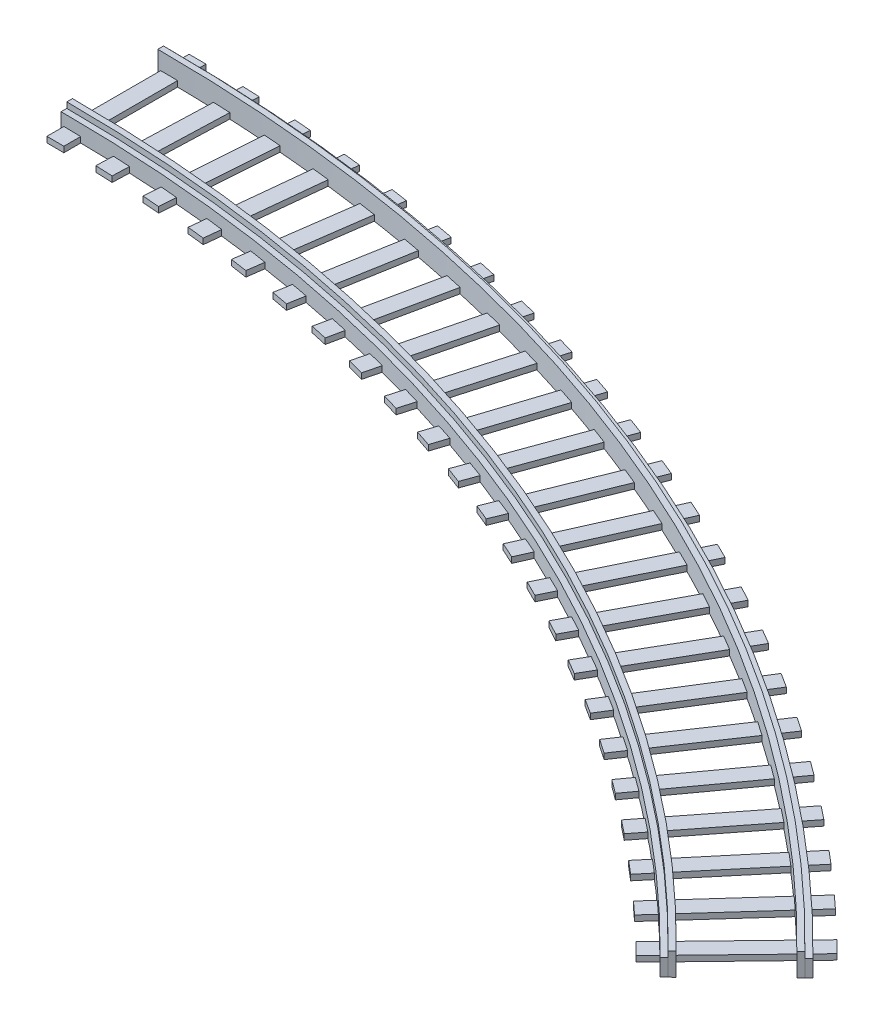
from build123d import *

# Parameters (mm, degrees)
BOSS_EXTRUDE1_DEPTH   = 4
BOSS_EXTRUDE1_2_DEPTH = 4
BOSS_EXTRUDE6_DEPTH   = 3
BOSS_EXTRUDE6_2_DEPTH = 3
BOSS_EXTRUDE3_DEPTH   = 1
CIRPATTERN2_COUNT     = 23
CIRPATTERN2_ANGLE     = 44


with BuildPart() as part:
    # Sketch1 → Boss-Extrude1 (new body)
    with BuildSketch(Plane(origin=(0, 0, 0), x_dir=(1, 0, 0), z_dir=(0, 1, 0))):
        with BuildLine():
            Line((193.554859662, 190.034414782), (194.268425964, 190.735002486))
            ThreePointArc((194.268425964, 190.735002486), (105.338639808, 251.045480866), (0, 272.25))
            Line((0, 272.25), (0, 271.25))
            ThreePointArc((0, 271.25), (104.951721021, 250.123367071), (193.554859662, 190.034414782))
        make_face()
    extrude(amount=BOSS_EXTRUDE1_DEPTH)


with BuildPart() as body_2:
    # Sketch1 → Boss-Extrude1 2 (new body)
    with BuildSketch(Plane(origin=(0, 0, 0), x_dir=(1, 0, 0), z_dir=(0, 1, 0))):
        with BuildLine():
            Line((182.851365118, 179.525599218), (182.137798815, 178.825011513))
            ThreePointArc((182.137798815, 178.825011513), (98.761020426, 235.36954634), (0, 255.25))
            Line((0, 255.25), (0, 256.25))
            ThreePointArc((0, 256.25), (99.147939213, 236.291660136), (182.851365118, 179.525599218))
        make_face()
    extrude(amount=BOSS_EXTRUDE1_2_DEPTH)


    add(part.part)  # Boss-Extrude3 merges part
    # Sketch3 → Boss-Extrude3 (add)
    with BuildSketch(Plane.XZ):
        with BuildLine():
            Line((0.5, -256.249512195), (0.5, -271.24953917))
            Line((0.5, -271.24953917), (0.5, -274.749545041))
            Line((0.5, -274.749545041), (0.5, -276.249547511))
            ThreePointArc((0.5, -276.249547511), (1.999988709, -276.242760168), (3.499918452, -276.227828198))
            Line((3.499918452, -276.227828198), (3.499918452, -274.727707141))
            Line((3.499918452, -274.727707141), (3.499918452, -271.227419467))
            Line((3.499918452, -271.227419467), (3.499918452, -256.22609756))
            Line((3.499918452, -256.22609756), (3.499918452, -252.725766535))
            Line((3.499918452, -252.725766535), (3.499918452, -251.225621844))
            ThreePointArc((3.499918452, -251.225621844), (1.999994869, -251.242039716), (0.5, -251.249502487))
            Line((0.5, -251.249502487), (0.5, -252.74950544))
            Line((0.5, -252.74950544), (0.5, -256.249512195))
        make_face()
    boss_extrude3 = extrude(amount=-BOSS_EXTRUDE3_DEPTH)

    # CirPattern2: Boss-Extrude3 ×23 about axis
    cirpattern2_axis = Axis((0, 4, 0), (0, -1, 0))
    for i in range(1, CIRPATTERN2_COUNT):
        add(boss_extrude3.rotate(cirpattern2_axis, i * CIRPATTERN2_ANGLE / (CIRPATTERN2_COUNT - 1)))


with BuildPart() as body_3:
    # Sketch6 → Boss-Extrude6 (new body)
    with BuildSketch(Plane.XZ):
        with BuildLine():
            Line((0, -255.25), (0, -254.25))
            ThreePointArc((0, -254.25), (98.374101639, -234.447432545), (181.424232512, -178.124423809))
            Line((181.424232512, -178.124423809), (182.137798815, -178.825011513))
            ThreePointArc((182.137798815, -178.825011513), (98.761020426, -235.36954634), (0, -255.25))
        make_face()
    extrude(amount=-BOSS_EXTRUDE6_DEPTH)


with BuildPart() as body_4:
    # Sketch6 → Boss-Extrude6 2 (new body)
    with BuildSketch(Plane.XZ):
        with BuildLine():
            Line((0, -272.25), (0, -273.25))
            ThreePointArc((0, -273.25), (105.725558595, -251.967594662), (194.981992267, -191.43559019))
            Line((194.981992267, -191.43559019), (194.268425964, -190.735002486))
            ThreePointArc((194.268425964, -190.735002486), (105.338639808, -251.045480866), (0, -272.25))
        make_face()
    extrude(amount=-BOSS_EXTRUDE6_2_DEPTH)


solid = Compound([body_2.part, body_3.part, body_4.part])
